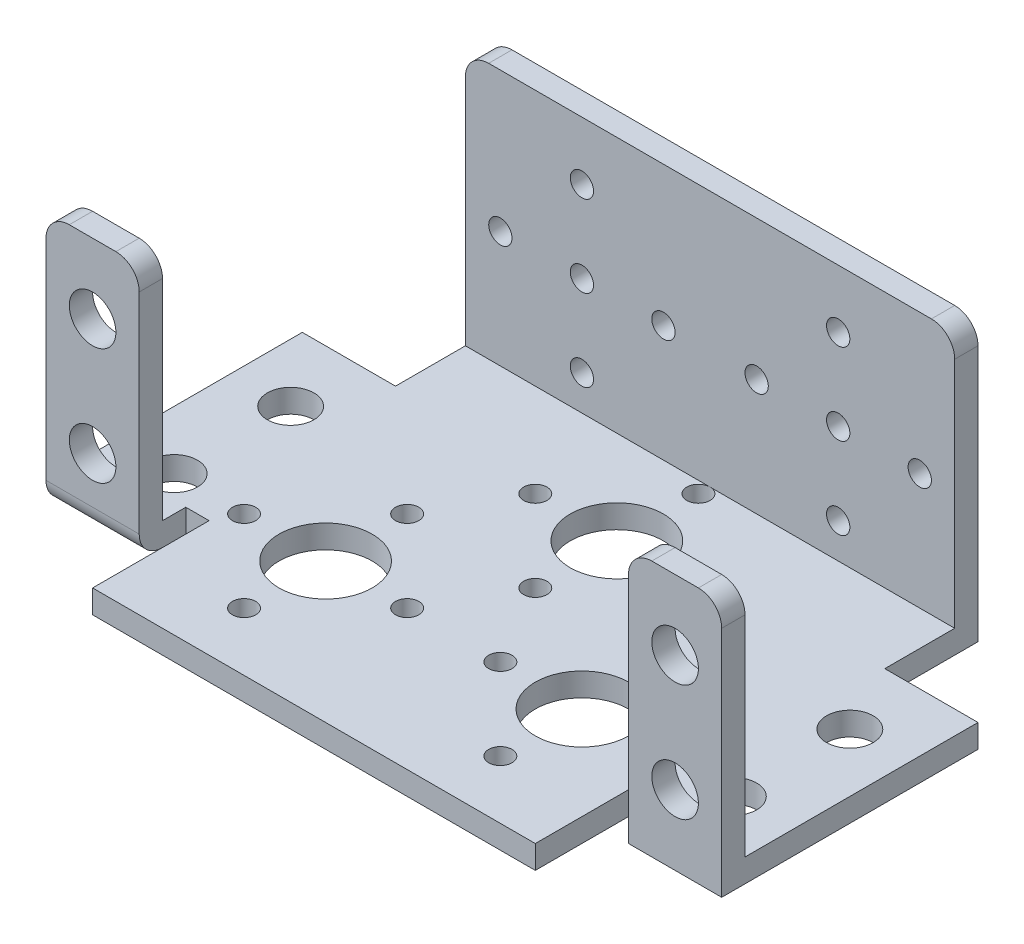
from build123d import *

# Parameters (mm, degrees)
SKETCH_1_R              = 4
SKETCH_1_R_2            = 1
SKETCH_1_R_3            = 2
EXTRUDE_1_DEPTH         = 2
FILLET_1_R              = 2
FILLET_2_R              = 2
FILLET_3_R              = 2
FILLET_4_R              = 2
SKETCH_2_W              = 42
SKETCH_2_H              = 24
SKETCH_2_R              = 1
EXTRUDE_2_DEPTH         = 2
FILLET_5_R              = 2
FILLET_6_R              = 2
FILLET_7_R              = 2
SKETCH_3_W              = 8
SKETCH_3_H              = 22
SKETCH_3_R              = 2
EXTRUDE_3_DEPTH         = 2
FILLET_8_R              = 2
FILLET_9_R              = 2
FILLET_10_R             = 2
FILLET_10_OF_MIRROR_3_R = 2
FILLET_11_R             = 2
FILLET_12_R             = 2


with BuildPart() as part:
    # 草图1 → 凸台-拉伸1 (new body)
    with BuildSketch(Plane(origin=(0, 0, 0), x_dir=(1, 0, 0), z_dir=(0, 1, 0))):
        Polygon((-29, 10), (-21, 10), (-21, 18), (21, 18), (21, 10), (29, 10), (29, -12), (21, -12), (21, -8), (19, -8), (19, -12), (19, -18), (-19, -18), (-19, -12), (-19, -8), (-21, -8), (-21, -12), (-29, -12), align=None)
        with Locations(Location((-11, -6, 0), (0, 0, 270))):
            Circle(SKETCH_1_R, mode=Mode.SUBTRACT)
        with Locations(Location((-11, 1, 0), (0, 0, 270))):
            Circle(SKETCH_1_R_2, mode=Mode.SUBTRACT)
        with Locations(Location((0, 8, 0), (0, 0, 270))):
            Circle(SKETCH_1_R, mode=Mode.SUBTRACT)
        with Locations(Location((0, 15, 0), (0, 0, 270))):
            Circle(SKETCH_1_R_2, mode=Mode.SUBTRACT)
        with Locations(Location((7, 8, 0), (0, 0, 270))):
            Circle(SKETCH_1_R_2, mode=Mode.SUBTRACT)
        with Locations(Location((0, 1, 0), (0, 0, 270))):
            Circle(SKETCH_1_R_2, mode=Mode.SUBTRACT)
        with Locations(Location((-7, 8, 0), (0, 0, 270))):
            Circle(SKETCH_1_R_2, mode=Mode.SUBTRACT)
        with Locations(Location((-4, -6, 0), (0, 0, 270))):
            Circle(SKETCH_1_R_2, mode=Mode.SUBTRACT)
        with Locations(Location((-11, -13, 0), (0, 0, 270))):
            Circle(SKETCH_1_R_2, mode=Mode.SUBTRACT)
        with Locations(Location((-18, -6, 0), (0, 0, 270))):
            Circle(SKETCH_1_R_2, mode=Mode.SUBTRACT)
        with Locations(Location((18, -6, 0), (0, 0, 90))):
            Circle(SKETCH_1_R_2, mode=Mode.SUBTRACT)
        with Locations(Location((11, -13, 0), (0, 0, 90))):
            Circle(SKETCH_1_R_2, mode=Mode.SUBTRACT)
        with Locations(Location((4, -6, 0), (0, 0, 90))):
            Circle(SKETCH_1_R_2, mode=Mode.SUBTRACT)
        with Locations(Location((11, -6, 0), (0, 0, 90))):
            Circle(SKETCH_1_R, mode=Mode.SUBTRACT)
        with Locations(Location((11, 1, 0), (0, 0, 90))):
            Circle(SKETCH_1_R_2, mode=Mode.SUBTRACT)
        with Locations(Location((24, -6, 0), (0, 0, 270))):
            Circle(SKETCH_1_R_3, mode=Mode.SUBTRACT)
        with Locations(Location((24, 4, 0), (0, 0, 270))):
            Circle(SKETCH_1_R_3, mode=Mode.SUBTRACT)
        with Locations(Location((-24, -6, 0), (0, 0, 90))):
            Circle(SKETCH_1_R_3, mode=Mode.SUBTRACT)
        with Locations(Location((-24, 4, 0), (0, 0, 90))):
            Circle(SKETCH_1_R_3, mode=Mode.SUBTRACT)
    extrude_1 = extrude(amount=EXTRUDE_1_DEPTH)

    # 圆角1
    fillet_1_edges = [part.edges().sort_by_distance(p)[0] for p in [
        (29, 1, -10),
    ]]
    fillet(fillet_1_edges, radius=FILLET_1_R)

    # 圆角2
    fillet_2_edges = [part.edges().sort_by_distance(p)[0] for p in [
        (-29, 1, -10),
    ]]
    fillet(fillet_2_edges, radius=FILLET_2_R)

    # 圆角3
    fillet_3_edges = [part.edges().sort_by_distance(p)[0] for p in [
        (-19, 1, 18),
    ]]
    fillet(fillet_3_edges, radius=FILLET_3_R)

    # 圆角4
    fillet_4_edges = [part.edges().sort_by_distance(p)[0] for p in [
        (19, 1, 18),
    ]]
    fillet(fillet_4_edges, radius=FILLET_4_R)

    # 草图2 → 凸台-拉伸2 (add)
    with BuildSketch(Plane(origin=(0, 0, -18), x_dir=(-1, 0, 0), z_dir=(0, 0, -1))):
        with Locations((0, 12)):
            Rectangle(SKETCH_2_W, SKETCH_2_H)
        with Locations((11, 12)):
            Circle(SKETCH_2_R, mode=Mode.SUBTRACT)
        with Locations((11, 19)):
            Circle(SKETCH_2_R, mode=Mode.SUBTRACT)
        with Locations((18, 12)):
            Circle(SKETCH_2_R, mode=Mode.SUBTRACT)
        with Locations((11, 5)):
            Circle(SKETCH_2_R, mode=Mode.SUBTRACT)
        with Locations((4, 12)):
            Circle(SKETCH_2_R, mode=Mode.SUBTRACT)
        with Locations(Location((-18, 12, 0), (0, 0, 180))):
            Circle(SKETCH_2_R, mode=Mode.SUBTRACT)
        with Locations(Location((-11, 19, 0), (0, 0, 180))):
            Circle(SKETCH_2_R, mode=Mode.SUBTRACT)
        with Locations(Location((-11, 5, 0), (0, 0, 180))):
            Circle(SKETCH_2_R, mode=Mode.SUBTRACT)
        with Locations(Location((-4, 12, 0), (0, 0, 180))):
            Circle(SKETCH_2_R, mode=Mode.SUBTRACT)
        with Locations(Location((-11, 12, 0), (0, 0, 180))):
            Circle(SKETCH_2_R, mode=Mode.SUBTRACT)
    extrude(amount=-EXTRUDE_2_DEPTH)

    # 圆角5
    fillet_5_edges = [part.edges().sort_by_distance(p)[0] for p in [
        (21, 24, -17),
    ]]
    fillet(fillet_5_edges, radius=FILLET_5_R)

    # 圆角6
    fillet_6_edges = [part.edges().sort_by_distance(p)[0] for p in [
        (-21, 24, -17),
    ]]
    fillet(fillet_6_edges, radius=FILLET_6_R)

    # 圆角7
    fillet_7_edges = [part.edges().sort_by_distance(p)[0] for p in [
        (0, 0, -18),
    ]]
    fillet(fillet_7_edges, radius=FILLET_7_R - 0.0001)  # a hair under: the kernel refuses the full size

    # 草图3 → 凸台-拉伸3 (add)
    with BuildSketch(Plane.XY.offset(12)):
        with Locations((25, 11)):
            Rectangle(SKETCH_3_W, SKETCH_3_H)
        with Locations((25, 16)):
            Circle(SKETCH_3_R, mode=Mode.SUBTRACT)
        with Locations((25, 6)):
            Circle(SKETCH_3_R, mode=Mode.SUBTRACT)
    extrude_3 = extrude(amount=-EXTRUDE_3_DEPTH)

    # 圆角8
    fillet_8_edges = [part.edges().sort_by_distance(p)[0] for p in [
        (25, 0, 12),
    ]]
    fillet(fillet_8_edges, radius=FILLET_8_R)

    # 圆角9
    fillet_9_edges = [part.edges().sort_by_distance(p)[0] for p in [
        (21, 22, 11),
    ]]
    fillet(fillet_9_edges, radius=FILLET_9_R)

    # 圆角10
    fillet_10_edges = [part.edges().sort_by_distance(p)[0] for p in [
        (29, 22, 11),
    ]]
    fillet(fillet_10_edges, radius=FILLET_10_R)

    # 镜向3: 凸台-拉伸1, 凸台-拉伸3 across plane
    add(extrude_1.mirror(Plane(origin=(0, 0, 0), x_dir=(0, 0, 1), z_dir=(1, 0, 0))))
    add(extrude_3.mirror(Plane(origin=(0, 0, 0), x_dir=(0, 0, 1), z_dir=(1, 0, 0))))

    # 圆角10 of 镜向3
    fillet_10_of_mirror_3_edges = [part.edges().sort_by_distance(p)[0] for p in [
        (-29, 22, 11),
    ]]
    fillet(fillet_10_of_mirror_3_edges, radius=FILLET_10_OF_MIRROR_3_R)

    # 圆角11
    fillet_11_edges = [part.edges().sort_by_distance(p)[0] for p in [
        (-21, 22, 11),
    ]]
    fillet(fillet_11_edges, radius=FILLET_11_R)

    # 圆角12
    fillet_12_edges = [part.edges().sort_by_distance(p)[0] for p in [
        (-25, 0, 12),
    ]]
    fillet(fillet_12_edges, radius=FILLET_12_R)


solid = part.part
